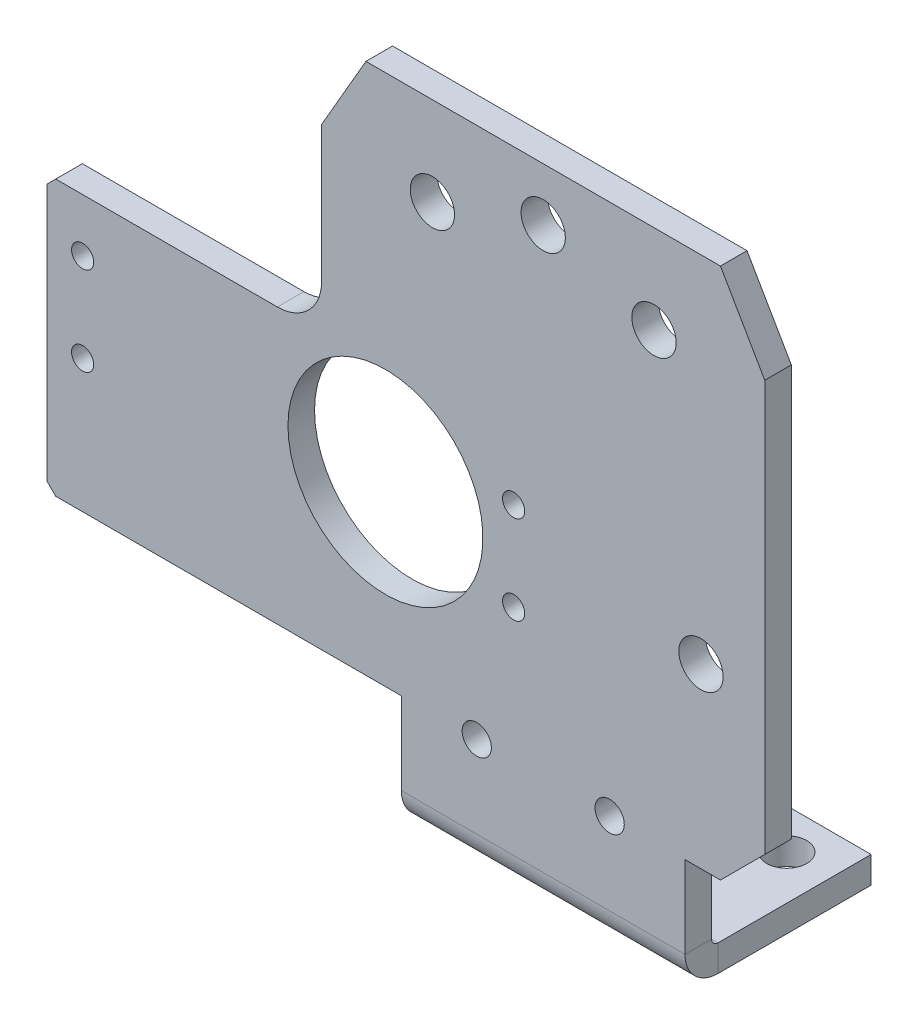
from build123d import *

# Parameters (mm, degrees)
SM_BASE_FLANGE_1_DEPTH           = 3
SKETCH_6_R                       = 2.5
CUT_EXTRUDE_1_DEPTH              = 3
CUT_EXTRUDE_2_REACH              = 68.106
SKETCH_9_R                       = 11
HOLE_WIZARD_M3_1_D               = 2.5
HOLE_WIZARD_M3_1_DEPTH           = 7.5
HOLE_WIZARD_M3_1_TIP             = 0.751075774
SM_EDGE_FLANGE_1_STRIP_W         = 13.4732
SM_EDGE_FLANGE_1_STRIP_H         = 3
SM_EDGE_FLANGE_1_STRIP_CUT_DEPTH = 32
SM_EDGE_FLANGE_1_DEPTH           = 32
HOLE_WIZARD_7_0_7_D              = 7
HOLE_WIZARD_7_0_7_DEPTH          = 6
HOLE_WIZARD_7_0_7_TIP            = 2.103012167
FILLET_1_R                       = 5
CHAMFER_1_SIZE                   = 1
HOLE_WIZARD_4_5_4_5_1_D          = 4.5
HOLE_WIZARD_4_5_4_5_1_DEPTH      = 5
HOLE_WIZARD_4_5_4_5_1_TIP        = 1.351936393
HOLE_WIZARD_M4_1_D               = 3.3
HOLE_WIZARD_M4_1_DEPTH           = 11.5
HOLE_WIZARD_M4_1_TIP             = 0.991420021


# Sheet-metal steps are written as plain solids
with BuildPart() as part:
    # Sketch 1 → 基体-法兰1 (new body)
    with BuildSketch(Plane.XY):
        Polygon((20, -25), (16, -25), (16, -35), (-16, -35), (-16, -25), (-56, -25), (-56, 6), (-25, 6), (-25, 26.339745962), (-20, 35), (20, 35), (25, 26.339745962), (25, -20), align=None)
    extrude(amount=-SM_BASE_FLANGE_1_DEPTH)

    # Sketch 6 → 切除-拉伸1 (cut)
    with BuildSketch(Plane.XY):
        with Locations((-17.8, -5)):
            Circle(SKETCH_6_R)
        with Locations((17.8, -5)):
            Circle(SKETCH_6_R)
        with Locations((0, 29)):
            Circle(SKETCH_6_R)
        with Locations((-12.5, 25)):
            Circle(SKETCH_6_R)
        with Locations(Location((12.5, 25, 0), (0, 0, 180))):
            Circle(SKETCH_6_R)
    extrude(amount=-CUT_EXTRUDE_1_DEPTH, mode=Mode.SUBTRACT)

    # Sketch 9 → 切除-拉伸2 (cut, up to next)
    with BuildSketch(Plane(origin=(0, 0, -3), x_dir=(-1, 0, 0), z_dir=(0, 0, -1)), mode=Mode.PRIVATE) as cut_extrude_2_sk1:
        with Locations((17.8, -5)):
            Circle(SKETCH_9_R)
    cut_extrude_2_tool1 = extrude(cut_extrude_2_sk1.sketch, amount=-CUT_EXTRUDE_2_REACH, mode=Mode.PRIVATE) & part.part
    add(cut_extrude_2_tool1.solids().sort_by_distance((-17.8, -5, -3))[0], mode=Mode.SUBTRACT)

    # M3 螺纹孔1
    with Locations(Plane(origin=(0, -38, 0), x_dir=(-1, 0, 0), z_dir=(0, 0, 1))):
        with Locations((51.965, -38), (51.965, -28), (3.335, -28), (3.335, -38)):
            Hole(HOLE_WIZARD_M3_1_D / 2, depth=HOLE_WIZARD_M3_1_DEPTH)
            with Locations((0, 0, -(HOLE_WIZARD_M3_1_DEPTH + HOLE_WIZARD_M3_1_TIP / 2))):  # 118° drill point
                Cone(0, HOLE_WIZARD_M3_1_D / 2, HOLE_WIZARD_M3_1_TIP, mode=Mode.SUBTRACT)

    # 边线-法兰1 strip (across the edge) → 边线-法兰1 strip cut (cut)
    with BuildSketch(Plane(origin=(16, -35, -3), x_dir=(0, 1, 0), z_dir=(-1, 0, 0))):
        with Locations((-6, -1.5)):
            Rectangle(SM_EDGE_FLANGE_1_STRIP_W, SM_EDGE_FLANGE_1_STRIP_H)
    extrude(amount=SM_EDGE_FLANGE_1_STRIP_CUT_DEPTH, mode=Mode.SUBTRACT)

    # 边线-法兰1 section (across the edge) → 边线-法兰1 (add)
    with BuildSketch(Plane(origin=(16, -35, -3), x_dir=(0, 1, 0), z_dir=(-1, 0, 0))):
        with BuildLine():
            Line((-3, 0.7366), (-3, 18))
            Line((-3, 18), (0, 18))
            Line((0, 18), (0, 0.7366))
            ThreePointArc((0, 0.7366), (0.215745145, 0.215745145), (0.7366, 0))
            Line((0.7366, 0), (0.7366, -3))
            ThreePointArc((0.7366, -3), (-1.905575199, -1.905575199), (-3, 0.7366))
        make_face()
    extrude(amount=SM_EDGE_FLANGE_1_DEPTH)

    # Ø7.0 (7) 直径孔
    with Locations(Plane(origin=(-9.85, -35, 1.271), x_dir=(1, 0, 0), z_dir=(0, 1, 0))):
        with Locations((9.85, 9.75)):
            Hole(HOLE_WIZARD_7_0_7_D / 2, depth=HOLE_WIZARD_7_0_7_DEPTH)
            with Locations((0, 0, -(HOLE_WIZARD_7_0_7_DEPTH + HOLE_WIZARD_7_0_7_TIP / 2))):  # 118° drill point
                Cone(0, HOLE_WIZARD_7_0_7_D / 2, HOLE_WIZARD_7_0_7_TIP, mode=Mode.SUBTRACT)

    # 圆角1
    fillet_1_edges = [part.edges().sort_by_distance(p)[0] for p in [
        (-25, 6, -1.5),
    ]]
    fillet(fillet_1_edges, radius=FILLET_1_R)

    # 倒角1
    chamfer_1_edges = [part.edges().sort_by_distance(p)[0] for p in [
        (-56, -25, -1.5),
        (-56, 6, -1.5),
    ]]
    chamfer(chamfer_1_edges, length=CHAMFER_1_SIZE)

    # Ø4.5 (4.5) 直径孔1
    with Locations(Plane(origin=(-9.85, -35, 1.271), x_dir=(1, 0, 0), z_dir=(0, 1, 0))):
        with Locations((-1.15, 17.75), (20.85, 17.75)):
            Hole(HOLE_WIZARD_4_5_4_5_1_D / 2, depth=HOLE_WIZARD_4_5_4_5_1_DEPTH)
            with Locations((0, 0, -(HOLE_WIZARD_4_5_4_5_1_DEPTH + HOLE_WIZARD_4_5_4_5_1_TIP / 2))):  # 118° drill point
                Cone(0, HOLE_WIZARD_4_5_4_5_1_D / 2, HOLE_WIZARD_4_5_4_5_1_TIP, mode=Mode.SUBTRACT)

    # M4 螺纹孔1
    with Locations(Plane(origin=(-9.85, -49.5, 0), x_dir=(-1, 0, 0), z_dir=(0, 0, 1))):
        with Locations((-2.35, -24.5), (-17.35, -24.5)):
            Hole(HOLE_WIZARD_M4_1_D / 2, depth=HOLE_WIZARD_M4_1_DEPTH)
            with Locations((0, 0, -(HOLE_WIZARD_M4_1_DEPTH + HOLE_WIZARD_M4_1_TIP / 2))):  # 118° drill point
                Cone(0, HOLE_WIZARD_M4_1_D / 2, HOLE_WIZARD_M4_1_TIP, mode=Mode.SUBTRACT)


solid = part.part
